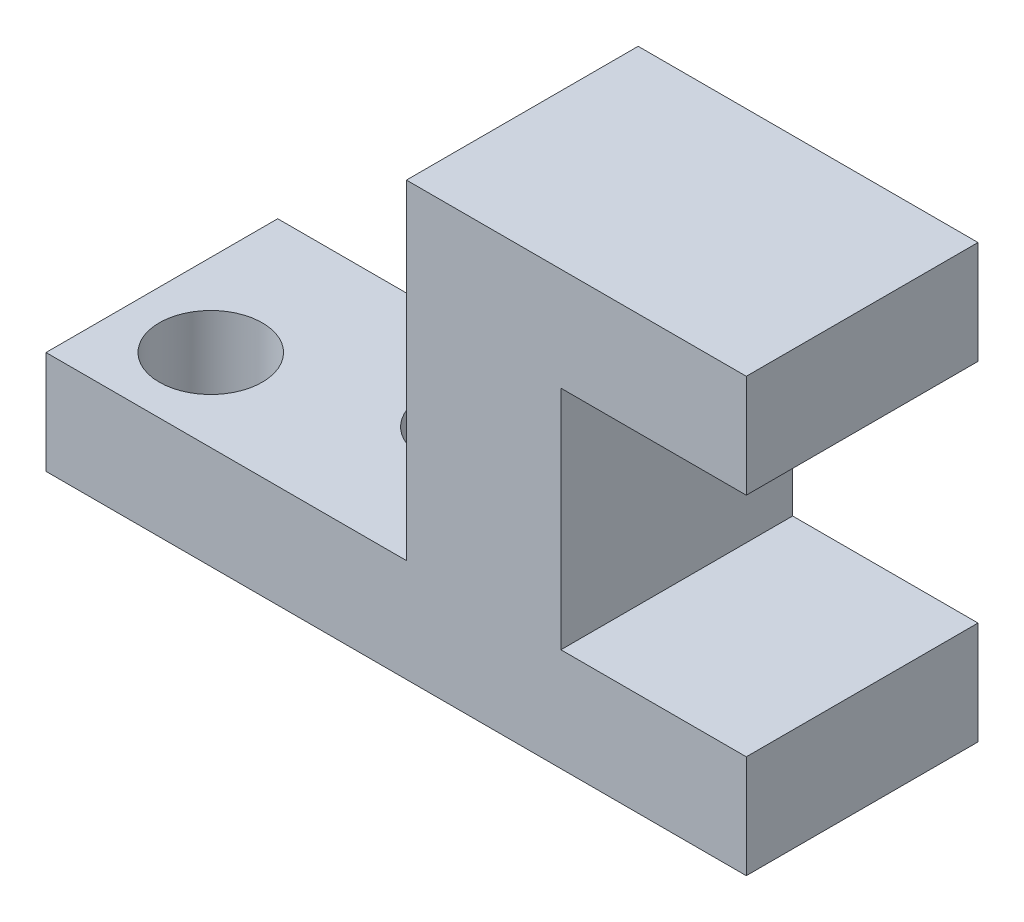
from build123d import *

# Parameters (mm, degrees)
BOSS_EXTRUDE1_DEPTH = 4.5
SKETCH2_R           = 1
CUT_EXTRUDE1_DEPTH  = 10


with BuildPart() as part:
    # Sketch1 → Boss-Extrude1 (new body)
    with BuildSketch(Plane.XY):
        Polygon((0, 0), (-13.6, 0), (-13.6, 2), (-6.6, 2), (-6.6, 8.4), (0, 8.4), (0, 6.4), (-3.6, 6.4), (-3.6, 2), (0, 2), align=None)
    extrude(amount=BOSS_EXTRUDE1_DEPTH)

    # Sketch2 → Cut-Extrude1 (cut)
    with BuildSketch(Plane(origin=(0, 2, 0), x_dir=(1, 0, 0), z_dir=(0, 1, 0))):
        with Locations((-8.2, -1.6)):
            Circle(SKETCH2_R)
        with Locations((-12, -2.9)):
            Circle(SKETCH2_R)
    extrude(amount=-CUT_EXTRUDE1_DEPTH, mode=Mode.SUBTRACT)


solid = part.part
